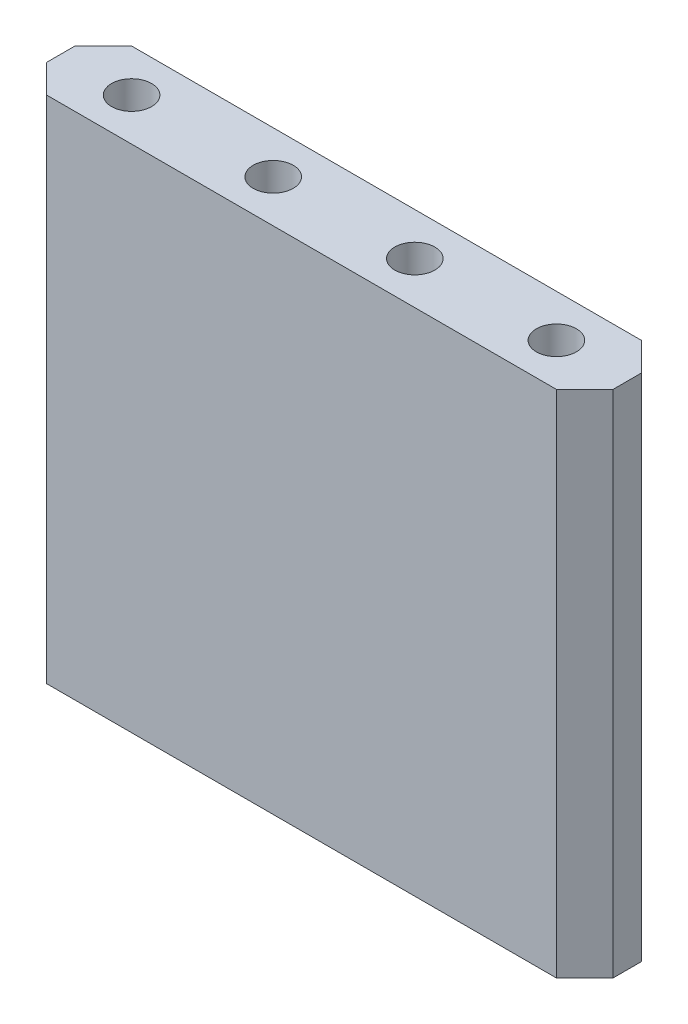
from build123d import *

# Parameters (mm, degrees)
SKETCH_1_W      = 10
SKETCH_1_H      = 1.5
SKETCH_1_W_2    = 0.5
SKETCH_1_H_2    = 0.5
EXTRUDE_1_DEPTH = 7
SKETCH_2_W      = 10
SKETCH_2_H      = 1.5
SKETCH_2_R      = 0.353553391
EXTRUDE_2_DEPTH = 2
CHAMFER_1_SIZE  = 0.5


with BuildPart() as part:
    # Эскиз1 → Бобышка-Вытянуть1 (new body)
    with BuildSketch(Plane(origin=(0, 0, 0), x_dir=(1, 0, 0), z_dir=(0, 1, 0))):
        Rectangle(SKETCH_1_W, SKETCH_1_H)
        with Locations((-3.75, 0)):
            Rectangle(SKETCH_1_W_2, SKETCH_1_H_2, mode=Mode.SUBTRACT)
        with Locations((3.75, 0)):
            Rectangle(SKETCH_1_W_2, SKETCH_1_H_2, mode=Mode.SUBTRACT)
        with Locations((-1.25, 0)):
            Rectangle(SKETCH_1_W_2, SKETCH_1_H_2, mode=Mode.SUBTRACT)
        with Locations((1.25, 0)):
            Rectangle(SKETCH_1_W_2, SKETCH_1_H_2, mode=Mode.SUBTRACT)
    extrude(amount=EXTRUDE_1_DEPTH)

    # Эскиз2 → Бобышка-Вытянуть2 (add)
    with BuildSketch(Plane(origin=(0, 7, 0), x_dir=(1, 0, 0), z_dir=(0, 1, 0))):
        Rectangle(SKETCH_2_W, SKETCH_2_H)
        with Locations((-3.75, 0)):
            Circle(SKETCH_2_R, mode=Mode.SUBTRACT)
        with Locations((-1.25, 0)):
            Circle(SKETCH_2_R, mode=Mode.SUBTRACT)
        with Locations((1.25, 0)):
            Circle(SKETCH_2_R, mode=Mode.SUBTRACT)
        with Locations((3.75, 0)):
            Circle(SKETCH_2_R, mode=Mode.SUBTRACT)
    extrude(amount=EXTRUDE_2_DEPTH)

    # Фаска1
    chamfer_1_edges = [part.edges().sort_by_distance(p)[0] for p in [
        (-5, 4.5, 0.75),
        (-5, 4.5, -0.75),
        (5, 4.5, 0.75),
        (5, 4.5, -0.75),
    ]]
    chamfer(chamfer_1_edges, length=CHAMFER_1_SIZE)


solid = part.part
